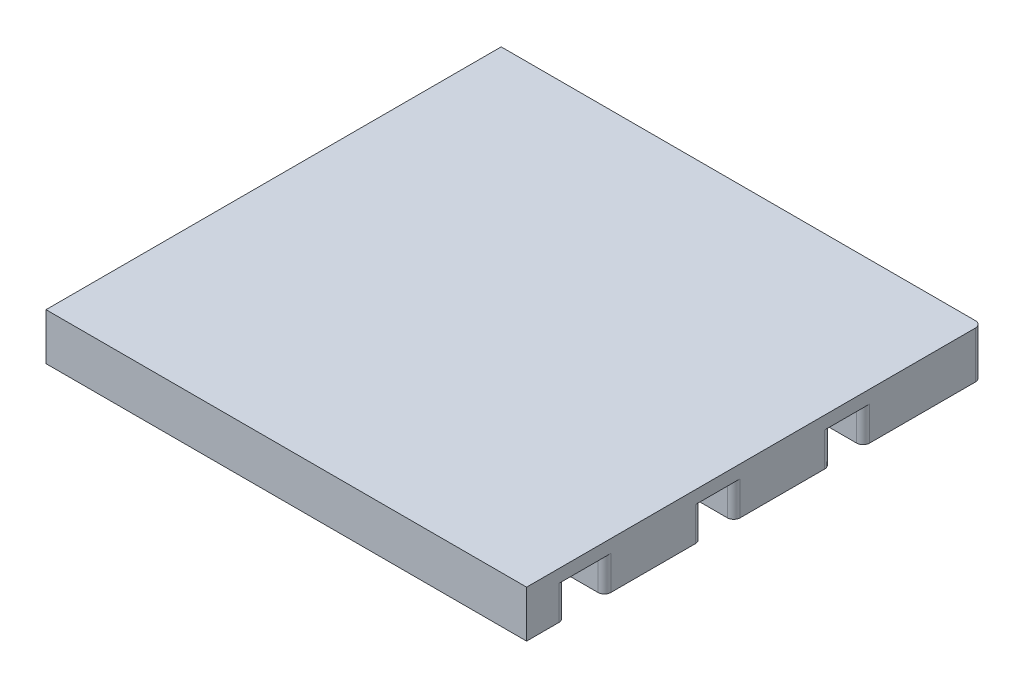
from build123d import *

# Parameters (mm, degrees)
SKETCH3_W           = 149
SKETCH3_H           = 141.12
BOSS_EXTRUDE1_DEPTH = 4
SKETCH5_W           = 67
SKETCH5_H           = 36.8
SKETCH5_H_2         = 30.2
BOSS_EXTRUDE2_DEPTH = 14.5
FILLET1_R           = 2
SKETCH6_W           = 149
SKETCH6_H           = 12
BOSS_EXTRUDE3_DEPTH = 10.5
FILLET2_R           = 2


with BuildPart() as part:
    # Sketch3 → Boss-Extrude1 (new body)
    with BuildSketch(Plane(origin=(0, 0, 0), x_dir=(1, 0, 0), z_dir=(0, 1, 0))):
        with Locations((74.5, -70.56)):
            Rectangle(SKETCH3_W, SKETCH3_H)
    extrude(amount=BOSS_EXTRUDE1_DEPTH)

    # Sketch5 → Boss-Extrude2 (add)
    # profile 1 of 6: a face of its own
    with BuildSketch(Plane(origin=(0, 4, 0), x_dir=(1, 0, 0), z_dir=(0, 1, 0))):
        with Locations((115.5, -18.4)):
            Rectangle(SKETCH5_W, SKETCH5_H)
        with BuildLine():
            ThreePointArc((97.3, -25), (95, -22.7), (97.3, -20.4))
            Line((97.3, -20.4), (124.6, -20.4))
            ThreePointArc((124.6, -20.4), (126.9, -22.7), (124.6, -25))
            Line((124.6, -25), (97.3, -25))
        make_face(mode=Mode.SUBTRACT)
    # profile 2 of 6: a face of its own
    with BuildSketch(Plane(origin=(0, 4, 0), x_dir=(1, 0, 0), z_dir=(0, 1, 0))):
        with Locations((115.5, -101.9)):
            Rectangle(SKETCH5_W, SKETCH5_H_2)
        with BuildLine():
            ThreePointArc((97.3, -105.2), (95, -102.9), (97.3, -100.6))
            Line((97.3, -100.6), (124.6, -100.6))
            ThreePointArc((124.6, -100.6), (126.9, -102.9), (124.6, -105.2))
            Line((124.6, -105.2), (97.3, -105.2))
        make_face(mode=Mode.SUBTRACT)
    # profile 3 of 6: a face of its own
    with BuildSketch(Plane(origin=(0, 4, 0), x_dir=(1, 0, 0), z_dir=(0, 1, 0))):
        with Locations((115.5, -61.8)):
            Rectangle(SKETCH5_W, SKETCH5_H_2)
        with BuildLine():
            ThreePointArc((97.3, -65.1), (95, -62.8), (97.3, -60.5))
            Line((97.3, -60.5), (124.6, -60.5))
            ThreePointArc((124.6, -60.5), (126.9, -62.8), (124.6, -65.1))
            Line((124.6, -65.1), (97.3, -65.1))
        make_face(mode=Mode.SUBTRACT)
    # profile 4 of 6: a face of its own
    with BuildSketch(Plane(origin=(0, 4, 0), x_dir=(1, 0, 0), z_dir=(0, 1, 0))):
        with Locations((33.5, -105.2)):
            Rectangle(SKETCH5_W, SKETCH5_H_2)
        with BuildLine():
            ThreePointArc((12.85, -108.5), (10.55, -106.2), (12.85, -103.9))
            Line((12.85, -103.9), (40.15, -103.9))
            ThreePointArc((40.15, -103.9), (42.45, -106.2), (40.15, -108.5))
            Line((40.15, -108.5), (12.85, -108.5))
        make_face(mode=Mode.SUBTRACT)
    # profile 5 of 6: a face of its own
    with BuildSketch(Plane(origin=(0, 4, 0), x_dir=(1, 0, 0), z_dir=(0, 1, 0))):
        with Locations((33.5, -65.1)):
            Rectangle(SKETCH5_W, SKETCH5_H_2)
        with BuildLine():
            ThreePointArc((12.85, -68.4), (10.55, -66.1), (12.85, -63.8))
            Line((12.85, -63.8), (40.15, -63.8))
            ThreePointArc((40.15, -63.8), (42.45, -66.1), (40.15, -68.4))
            Line((40.15, -68.4), (12.85, -68.4))
        make_face(mode=Mode.SUBTRACT)
    # profile 6 of 6: a face of its own
    with BuildSketch(Plane(origin=(0, 4, 0), x_dir=(1, 0, 0), z_dir=(0, 1, 0))):
        with Locations((33.5, -25)):
            Rectangle(SKETCH5_W, SKETCH5_H_2)
        with BuildLine():
            ThreePointArc((12.85, -28.3), (10.55, -26), (12.85, -23.7))
            Line((12.85, -23.7), (40.15, -23.7))
            ThreePointArc((40.15, -23.7), (42.45, -26), (40.15, -28.3))
            Line((40.15, -28.3), (12.85, -28.3))
        make_face(mode=Mode.SUBTRACT)
    extrude(amount=-BOSS_EXTRUDE2_DEPTH)

    # Fillet1
    fillet1_edges = [part.edges().sort_by_distance(p)[0] for p in [
        (149, -5.25, 86.8),
        (149, -5.25, 117),
        (82, -5.25, 117),
        (82, -5.25, 86.8),
        (67, -5.25, 90.1),
        (67, -5.25, 120.3),
        (0, -5.25, 120.3),
        (0, -5.25, 90.1),
        (0, -5.25, 80.2),
        (82, -5.25, 76.9),
        (149, -5.25, 76.9),
        (149, -5.25, 46.7),
        (82, -5.25, 46.7),
        (67, -5.25, 50),
        (67, -5.25, 80.2),
        (0, -5.25, 50),
        (0, -5.25, 40.1),
        (67, -5.25, 40.1),
        (82, -5.25, 36.8),
        (149, -5.25, 36.8),
        (149, -3.25, 0),
        (82, -5.25, 0),
        (67, -5.25, 9.9),
        (0, -5.25, 9.9),
    ]]
    fillet(fillet1_edges, radius=FILLET1_R)

    # Sketch6 → Boss-Extrude3 (add)
    with BuildSketch(Plane.XZ):
        with Locations((74.5, 135.12)):
            Rectangle(SKETCH6_W, SKETCH6_H)
    extrude(amount=BOSS_EXTRUDE3_DEPTH)

    # Fillet2
    fillet2_edges = [part.edges().sort_by_distance(p)[0] for p in [
        (149, -5.25, 129.12),
        (0, -5.25, 129.12),
    ]]
    fillet(fillet2_edges, radius=FILLET2_R)


solid = part.part
